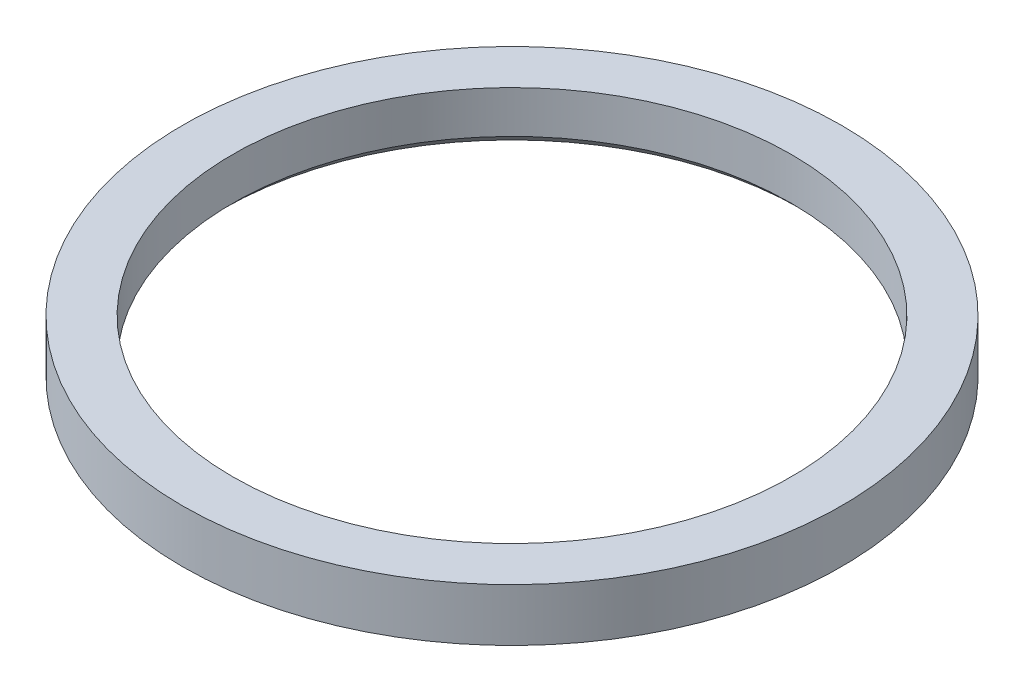
from build123d import *

# Parameters (mm, degrees)
SKETCH1_R           = 9.5
BOSS_EXTRUDE1_DEPTH = 1.52
SKETCH2_R           = 8.05
CUT_EXTRUDE1_DEPTH  = 14.520739625
CHAMFER1_SIZE       = 0.3


with BuildPart() as part:
    # Sketch1 → Boss-Extrude1 (new body)
    with BuildSketch(Plane(origin=(0, 0, 0), x_dir=(1, 0, 0), z_dir=(0, 1, 0))):
        Circle(SKETCH1_R)
    extrude(amount=BOSS_EXTRUDE1_DEPTH)

    # Sketch2 → Cut-Extrude1 (cut, through all)
    with BuildSketch(Plane(origin=(0, 1.52, 0), x_dir=(1, 0, 0), z_dir=(0, 1, 0))):
        Circle(SKETCH2_R)
    extrude(amount=-CUT_EXTRUDE1_DEPTH, mode=Mode.SUBTRACT)

    # Chamfer1
    chamfer1_edges = [part.edges().sort_by_distance(p)[0] for p in [
        (-8.05, 0, 0),
    ]]
    chamfer(chamfer1_edges, length=CHAMFER1_SIZE)


solid = part.part
